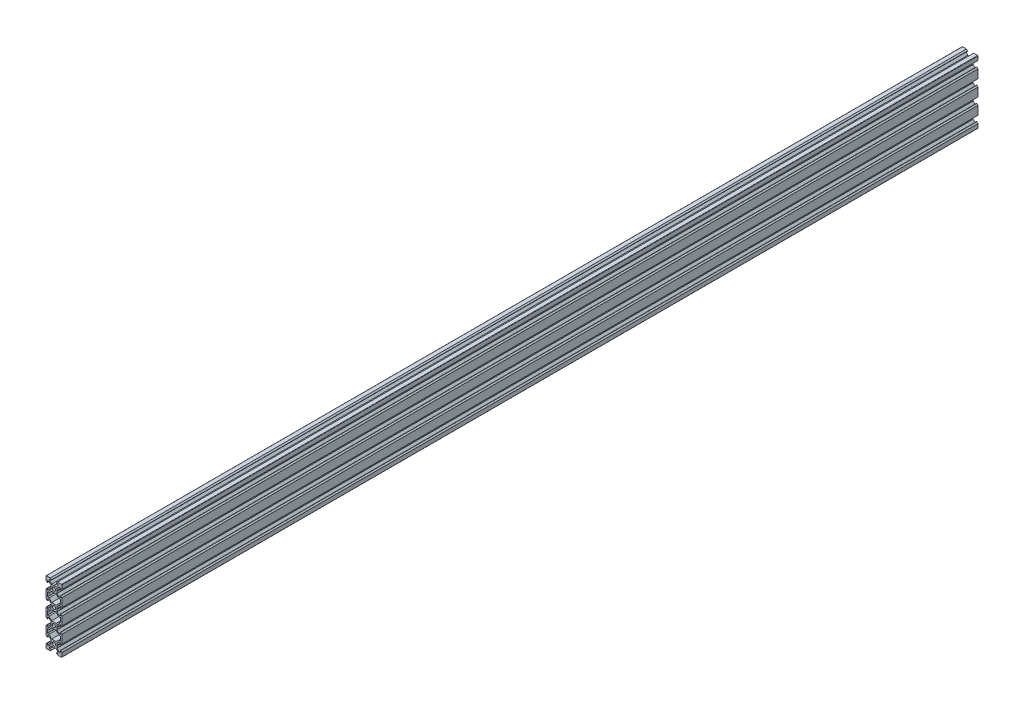
from build123d import *

# Parameters (mm, degrees)
V_SLOT_START                            = -48.53464623
V_SLOT_20X80X1000_LINEAR_RAIL_OUTLINE_R = 2.1
V_SLOT_20X80X1000_LINEAR_RAIL_DEPTH     = 1000
BOSS_EXTRUDE1_START                     = 160
SKETCH1_R                               = 2.1
BOSS_EXTRUDE1_DEPTH                     = 160


# Read off the part's stored shape, not the designer's step: V-Slot 20x80x1000 Linear Rail
with BuildPart() as part:
    # V-Slot 20x80x1000 Linear Rail outline → V-Slot 20x80x1000 Linear Rail (new body)
    with BuildSketch(Plane.XY.offset(V_SLOT_START)):
        with BuildLine():
            Line((20.643413128, 85.594922365), (20.643413128, 88.224262193))
            Line((20.643413128, 88.224262193), (20.433413128, 88.434262193))
            Line((20.433413128, 88.434262193), (20.643413128, 88.644262193))
            Line((20.643413128, 88.644262193), (20.643413128, 91.273602021))
            Line((20.643413128, 91.273602021), (23.3040733, 93.934262193))
            Line((23.3040733, 93.934262193), (24.943413128, 93.934262193))
            Line((24.943413128, 93.934262193), (24.943413128, 91.559262193))
            Line((24.943413128, 91.559262193), (25.288413128, 91.559262193))
            Line((25.288413128, 91.559262193), (26.743413128, 93.014262193))
            Line((26.743413128, 93.014262193), (26.743413128, 97.934262193))
            ThreePointArc((26.743413128, 97.934262193), (26.596966518, 98.287815583), (26.243413128, 98.434262193))
            Line((26.243413128, 98.434262193), (21.323413128, 98.434262193))
            Line((21.323413128, 98.434262193), (19.868413128, 96.979262193))
            Line((19.868413128, 96.979262193), (19.868413128, 96.634262193))
            Line((19.868413128, 96.634262193), (22.243413128, 96.634262193))
            Line((22.243413128, 96.634262193), (22.243413128, 94.994922365))
            Line((22.243413128, 94.994922365), (19.582752956, 92.334262193))
            Line((19.582752956, 92.334262193), (16.953413128, 92.334262193))
            Line((16.953413128, 92.334262193), (16.743413128, 92.124262193))
            Line((16.743413128, 92.124262193), (16.533413128, 92.334262193))
            Line((16.533413128, 92.334262193), (13.9040733, 92.334262193))
            Line((13.9040733, 92.334262193), (11.243413128, 94.994922365))
            Line((11.243413128, 94.994922365), (11.243413128, 96.634262193))
            Line((11.243413128, 96.634262193), (13.618413128, 96.634262193))
            Line((13.618413128, 96.634262193), (13.618413128, 96.979262193))
            Line((13.618413128, 96.979262193), (12.163413128, 98.434262193))
            Line((12.163413128, 98.434262193), (7.243413128, 98.434262193))
            ThreePointArc((7.243413128, 98.434262193), (6.889859737, 98.287815583), (6.743413128, 97.934262193))
            Line((6.743413128, 97.934262193), (6.743413128, 93.014262193))
            Line((6.743413128, 93.014262193), (8.198413128, 91.559262193))
            Line((8.198413128, 91.559262193), (8.543413128, 91.559262193))
            Line((8.543413128, 91.559262193), (8.543413128, 93.934262193))
            Line((8.543413128, 93.934262193), (10.182752956, 93.934262193))
            Line((10.182752956, 93.934262193), (12.843413128, 91.273602021))
            Line((12.843413128, 91.273602021), (12.843413128, 88.644262193))
            Line((12.843413128, 88.644262193), (13.053413128, 88.434262193))
            Line((13.053413128, 88.434262193), (12.843413128, 88.224262193))
            Line((12.843413128, 88.224262193), (12.843413128, 85.594922365))
            Line((12.843413128, 85.594922365), (10.182752956, 82.934262193))
            Line((10.182752956, 82.934262193), (8.543413128, 82.934262193))
            Line((8.543413128, 82.934262193), (8.543413128, 85.309262193))
            Line((8.543413128, 85.309262193), (8.198413128, 85.309262193))
            Line((8.198413128, 85.309262193), (6.743413128, 83.854262193))
            Line((6.743413128, 83.854262193), (6.743413128, 73.014262193))
            Line((6.743413128, 73.014262193), (8.198413128, 71.559262193))
            Line((8.198413128, 71.559262193), (8.543413128, 71.559262193))
            Line((8.543413128, 71.559262193), (8.543413128, 73.934262193))
            Line((8.543413128, 73.934262193), (10.182752956, 73.934262193))
            Line((10.182752956, 73.934262193), (12.843413128, 71.273602021))
            Line((12.843413128, 71.273602021), (12.843413128, 68.644262193))
            Line((12.843413128, 68.644262193), (13.053413128, 68.434262193))
            Line((13.053413128, 68.434262193), (12.843413128, 68.224262193))
            Line((12.843413128, 68.224262193), (12.843413128, 65.594922365))
            Line((12.843413128, 65.594922365), (10.182752956, 62.934262193))
            Line((10.182752956, 62.934262193), (8.543413128, 62.934262193))
            Line((8.543413128, 62.934262193), (8.543413128, 65.309262193))
            Line((8.543413128, 65.309262193), (8.198413128, 65.309262193))
            Line((8.198413128, 65.309262193), (6.743413128, 63.854262193))
            Line((6.743413128, 63.854262193), (6.743413128, 53.014262193))
            Line((6.743413128, 53.014262193), (8.198413128, 51.559262193))
            Line((8.198413128, 51.559262193), (8.543413128, 51.559262193))
            Line((8.543413128, 51.559262193), (8.543413128, 53.934262193))
            Line((8.543413128, 53.934262193), (10.182752956, 53.934262193))
            Line((10.182752956, 53.934262193), (12.843413128, 51.273602021))
            Line((12.843413128, 51.273602021), (12.843413128, 48.644262193))
            Line((12.843413128, 48.644262193), (13.053413128, 48.434262193))
            Line((13.053413128, 48.434262193), (12.843413128, 48.224262193))
            Line((12.843413128, 48.224262193), (12.843413128, 45.594922365))
            Line((12.843413128, 45.594922365), (10.182752956, 42.934262193))
            Line((10.182752956, 42.934262193), (8.543413128, 42.934262193))
            Line((8.543413128, 42.934262193), (8.543413128, 45.309262193))
            Line((8.543413128, 45.309262193), (8.198413128, 45.309262193))
            Line((8.198413128, 45.309262193), (6.743413128, 43.854262193))
            Line((6.743413128, 43.854262193), (6.743413128, 33.014262193))
            Line((6.743413128, 33.014262193), (8.198413128, 31.559262193))
            Line((8.198413128, 31.559262193), (8.543413128, 31.559262193))
            Line((8.543413128, 31.559262193), (8.543413128, 33.934262193))
            Line((8.543413128, 33.934262193), (10.182752956, 33.934262193))
            Line((10.182752956, 33.934262193), (12.843413128, 31.273602021))
            Line((12.843413128, 31.273602021), (12.843413128, 28.644262193))
            Line((12.843413128, 28.644262193), (13.053413128, 28.434262193))
            Line((13.053413128, 28.434262193), (12.843413128, 28.224262193))
            Line((12.843413128, 28.224262193), (12.843413128, 25.594922365))
            Line((12.843413128, 25.594922365), (10.182752956, 22.934262193))
            Line((10.182752956, 22.934262193), (8.543413128, 22.934262193))
            Line((8.543413128, 22.934262193), (8.543413128, 25.309262193))
            Line((8.543413128, 25.309262193), (8.198413128, 25.309262193))
            Line((8.198413128, 25.309262193), (6.743413128, 23.854262193))
            Line((6.743413128, 23.854262193), (6.743413128, 18.934262193))
            ThreePointArc((6.743413128, 18.934262193), (6.889859737, 18.580708802), (7.243413128, 18.434262193))
            Line((7.243413128, 18.434262193), (12.163413128, 18.434262193))
            Line((12.163413128, 18.434262193), (13.618413128, 19.889262193))
            Line((13.618413128, 19.889262193), (13.618413128, 20.234262193))
            Line((13.618413128, 20.234262193), (11.243413128, 20.234262193))
            Line((11.243413128, 20.234262193), (11.243413128, 21.873602021))
            Line((11.243413128, 21.873602021), (13.9040733, 24.534262193))
            Line((13.9040733, 24.534262193), (16.533413128, 24.534262193))
            Line((16.533413128, 24.534262193), (16.743413128, 24.744262193))
            Line((16.743413128, 24.744262193), (16.953413128, 24.534262193))
            Line((16.953413128, 24.534262193), (19.582752956, 24.534262193))
            Line((19.582752956, 24.534262193), (22.243413128, 21.873602021))
            Line((22.243413128, 21.873602021), (22.243413128, 20.234262193))
            Line((22.243413128, 20.234262193), (19.868413128, 20.234262193))
            Line((19.868413128, 20.234262193), (19.868413128, 19.889262193))
            Line((19.868413128, 19.889262193), (21.323413128, 18.434262193))
            Line((21.323413128, 18.434262193), (26.243413128, 18.434262193))
            ThreePointArc((26.243413128, 18.434262193), (26.596966519, 18.580708802), (26.743413128, 18.934262193))
            Line((26.743413128, 18.934262193), (26.743413128, 23.854262193))
            Line((26.743413128, 23.854262193), (25.288413128, 25.309262193))
            Line((25.288413128, 25.309262193), (24.943413128, 25.309262193))
            Line((24.943413128, 25.309262193), (24.943413128, 22.934262193))
            Line((24.943413128, 22.934262193), (23.3040733, 22.934262193))
            Line((23.3040733, 22.934262193), (20.643413128, 25.594922365))
            Line((20.643413128, 25.594922365), (20.643413128, 28.224262193))
            Line((20.643413128, 28.224262193), (20.433413128, 28.434262193))
            Line((20.433413128, 28.434262193), (20.643413128, 28.644262193))
            Line((20.643413128, 28.644262193), (20.643413128, 31.273602021))
            Line((20.643413128, 31.273602021), (23.3040733, 33.934262193))
            Line((23.3040733, 33.934262193), (24.943413128, 33.934262193))
            Line((24.943413128, 33.934262193), (24.943413128, 31.559262193))
            Line((24.943413128, 31.559262193), (25.288413128, 31.559262193))
            Line((25.288413128, 31.559262193), (26.743413128, 33.014262193))
            Line((26.743413128, 33.014262193), (26.743413128, 43.854262193))
            Line((26.743413128, 43.854262193), (25.288413128, 45.309262193))
            Line((25.288413128, 45.309262193), (24.943413128, 45.309262193))
            Line((24.943413128, 45.309262193), (24.943413128, 42.934262193))
            Line((24.943413128, 42.934262193), (23.3040733, 42.934262193))
            Line((23.3040733, 42.934262193), (20.643413128, 45.594922365))
            Line((20.643413128, 45.594922365), (20.643413128, 48.224262193))
            Line((20.643413128, 48.224262193), (20.433413128, 48.434262193))
            Line((20.433413128, 48.434262193), (20.643413128, 48.644262193))
            Line((20.643413128, 48.644262193), (20.643413128, 51.273602021))
            Line((20.643413128, 51.273602021), (23.3040733, 53.934262193))
            Line((23.3040733, 53.934262193), (24.943413128, 53.934262193))
            Line((24.943413128, 53.934262193), (24.943413128, 51.559262193))
            Line((24.943413128, 51.559262193), (25.288413128, 51.559262193))
            Line((25.288413128, 51.559262193), (26.743413128, 53.014262193))
            Line((26.743413128, 53.014262193), (26.743413128, 63.854262193))
            Line((26.743413128, 63.854262193), (25.288413128, 65.309262193))
            Line((25.288413128, 65.309262193), (24.943413128, 65.309262193))
            Line((24.943413128, 65.309262193), (24.943413128, 62.934262193))
            Line((24.943413128, 62.934262193), (23.3040733, 62.934262193))
            Line((23.3040733, 62.934262193), (20.643413128, 65.594922365))
            Line((20.643413128, 65.594922365), (20.643413128, 68.224262193))
            Line((20.643413128, 68.224262193), (20.433413128, 68.434262193))
            Line((20.433413128, 68.434262193), (20.643413128, 68.644262193))
            Line((20.643413128, 68.644262193), (20.643413128, 71.273602021))
            Line((20.643413128, 71.273602021), (23.3040733, 73.934262193))
            Line((23.3040733, 73.934262193), (24.943413128, 73.934262193))
            Line((24.943413128, 73.934262193), (24.943413128, 71.559262193))
            Line((24.943413128, 71.559262193), (25.288413128, 71.559262193))
            Line((25.288413128, 71.559262193), (26.743413128, 73.014262193))
            Line((26.743413128, 73.014262193), (26.743413128, 83.854262193))
            Line((26.743413128, 83.854262193), (25.288413128, 85.309262193))
            Line((25.288413128, 85.309262193), (24.943413128, 85.309262193))
            Line((24.943413128, 85.309262193), (24.943413128, 82.934262193))
            Line((24.943413128, 82.934262193), (23.3040733, 82.934262193))
            Line((23.3040733, 82.934262193), (20.643413128, 85.594922365))
        make_face()
        with Locations((16.743413128, 28.434262193)):
            Circle(V_SLOT_20X80X1000_LINEAR_RAIL_OUTLINE_R, mode=Mode.SUBTRACT)
        Polygon((13.9040733, 32.334262193), (10.5040733, 35.734262193), (8.543413128, 35.734262193), (8.543413128, 41.134262193), (10.5040733, 41.134262193), (13.9040733, 44.534262193), (19.582752956, 44.534262193), (22.982752956, 41.134262193), (24.943413128, 41.134262193), (24.943413128, 35.734262193), (22.982752956, 35.734262193), (19.582752956, 32.334262193), align=None, mode=Mode.SUBTRACT)
        with Locations((16.743413128, 48.434262193)):
            Circle(V_SLOT_20X80X1000_LINEAR_RAIL_OUTLINE_R, mode=Mode.SUBTRACT)
        Polygon((13.9040733, 52.334262193), (10.5040733, 55.734262193), (8.543413128, 55.734262193), (8.543413128, 61.134262193), (10.5040733, 61.134262193), (13.9040733, 64.534262193), (19.582752956, 64.534262193), (22.982752956, 61.134262193), (24.943413128, 61.134262193), (24.943413128, 55.734262193), (22.982752956, 55.734262193), (19.582752956, 52.334262193), align=None, mode=Mode.SUBTRACT)
        with Locations((16.743413128, 68.434262193)):
            Circle(V_SLOT_20X80X1000_LINEAR_RAIL_OUTLINE_R, mode=Mode.SUBTRACT)
        Polygon((13.9040733, 72.334262193), (10.5040733, 75.734262193), (8.543413128, 75.734262193), (8.543413128, 81.134262193), (10.5040733, 81.134262193), (13.9040733, 84.534262193), (19.582752956, 84.534262193), (22.982752956, 81.134262193), (24.943413128, 81.134262193), (24.943413128, 75.734262193), (22.982752956, 75.734262193), (19.582752956, 72.334262193), align=None, mode=Mode.SUBTRACT)
        with Locations((16.743413128, 88.434262193)):
            Circle(V_SLOT_20X80X1000_LINEAR_RAIL_OUTLINE_R, mode=Mode.SUBTRACT)
    extrude(amount=V_SLOT_20X80X1000_LINEAR_RAIL_DEPTH)

    # Sketch1 → Boss-Extrude1 (add)
    with BuildSketch(Plane(origin=(0, 0, -48.53464623), x_dir=(-1, 0, 0), z_dir=(0, 0, -1)).offset(BOSS_EXTRUDE1_START)):
        with BuildLine():
            Line((-20.433413128, 88.434262193), (-20.643413128, 88.224262193))
            Line((-20.643413128, 88.224262193), (-20.643413128, 85.594922365))
            Line((-20.643413128, 85.594922365), (-23.3040733, 82.934262193))
            Line((-23.3040733, 82.934262193), (-24.943413128, 82.934262193))
            Line((-24.943413128, 82.934262193), (-24.943413128, 85.309262193))
            Line((-24.943413128, 85.309262193), (-25.288413128, 85.309262193))
            Line((-25.288413128, 85.309262193), (-26.743413128, 83.854262193))
            Line((-26.743413128, 83.854262193), (-26.743413128, 73.014262193))
            Line((-26.743413128, 73.014262193), (-25.288413128, 71.559262193))
            Line((-25.288413128, 71.559262193), (-24.943413128, 71.559262193))
            Line((-24.943413128, 71.559262193), (-24.943413128, 73.934262193))
            Line((-24.943413128, 73.934262193), (-23.3040733, 73.934262193))
            Line((-23.3040733, 73.934262193), (-20.643413128, 71.273602021))
            Line((-20.643413128, 71.273602021), (-20.643413128, 68.644262193))
            Line((-20.643413128, 68.644262193), (-20.433413128, 68.434262193))
            Line((-20.433413128, 68.434262193), (-20.643413128, 68.224262193))
            Line((-20.643413128, 68.224262193), (-20.643413128, 65.594922365))
            Line((-20.643413128, 65.594922365), (-23.3040733, 62.934262193))
            Line((-23.3040733, 62.934262193), (-24.943413128, 62.934262193))
            Line((-24.943413128, 62.934262193), (-24.943413128, 65.309262193))
            Line((-24.943413128, 65.309262193), (-25.288413128, 65.309262193))
            Line((-25.288413128, 65.309262193), (-26.743413128, 63.854262193))
            Line((-26.743413128, 63.854262193), (-26.743413128, 53.014262193))
            Line((-26.743413128, 53.014262193), (-25.288413128, 51.559262193))
            Line((-25.288413128, 51.559262193), (-24.943413128, 51.559262193))
            Line((-24.943413128, 51.559262193), (-24.943413128, 53.934262193))
            Line((-24.943413128, 53.934262193), (-23.3040733, 53.934262193))
            Line((-23.3040733, 53.934262193), (-20.643413128, 51.273602021))
            Line((-20.643413128, 51.273602021), (-20.643413128, 48.644262193))
            Line((-20.643413128, 48.644262193), (-20.433413128, 48.434262193))
            Line((-20.433413128, 48.434262193), (-20.643413128, 48.224262193))
            Line((-20.643413128, 48.224262193), (-20.643413128, 45.594922365))
            Line((-20.643413128, 45.594922365), (-23.3040733, 42.934262193))
            Line((-23.3040733, 42.934262193), (-24.943413128, 42.934262193))
            Line((-24.943413128, 42.934262193), (-24.943413128, 45.309262193))
            Line((-24.943413128, 45.309262193), (-25.288413128, 45.309262193))
            Line((-25.288413128, 45.309262193), (-26.743413128, 43.854262193))
            Line((-26.743413128, 43.854262193), (-26.743413128, 33.014262193))
            Line((-26.743413128, 33.014262193), (-25.288413128, 31.559262193))
            Line((-25.288413128, 31.559262193), (-24.943413128, 31.559262193))
            Line((-24.943413128, 31.559262193), (-24.943413128, 33.934262193))
            Line((-24.943413128, 33.934262193), (-23.3040733, 33.934262193))
            Line((-23.3040733, 33.934262193), (-20.643413128, 31.273602021))
            Line((-20.643413128, 31.273602021), (-20.643413128, 28.644262193))
            Line((-20.643413128, 28.644262193), (-20.433413128, 28.434262193))
            Line((-20.433413128, 28.434262193), (-20.643413128, 28.224262193))
            Line((-20.643413128, 28.224262193), (-20.643413128, 25.594922365))
            Line((-20.643413128, 25.594922365), (-23.3040733, 22.934262193))
            Line((-23.3040733, 22.934262193), (-24.943413128, 22.934262193))
            Line((-24.943413128, 22.934262193), (-24.943413128, 25.309262193))
            Line((-24.943413128, 25.309262193), (-25.288413128, 25.309262193))
            Line((-25.288413128, 25.309262193), (-26.743413128, 23.854262193))
            Line((-26.743413128, 23.854262193), (-26.743413128, 18.934262193))
            ThreePointArc((-26.743413128, 18.934262193), (-26.596966518, 18.580708802), (-26.243413128, 18.434262193))
            Line((-26.243413128, 18.434262193), (-21.323413128, 18.434262193))
            Line((-21.323413128, 18.434262193), (-19.868413128, 19.889262193))
            Line((-19.868413128, 19.889262193), (-19.868413128, 20.234262193))
            Line((-19.868413128, 20.234262193), (-22.243413128, 20.234262193))
            Line((-22.243413128, 20.234262193), (-22.243413128, 21.873602021))
            Line((-22.243413128, 21.873602021), (-19.582752956, 24.534262193))
            Line((-19.582752956, 24.534262193), (-16.953413128, 24.534262193))
            Line((-16.953413128, 24.534262193), (-16.743413128, 24.744262193))
            Line((-16.743413128, 24.744262193), (-16.533413128, 24.534262193))
            Line((-16.533413128, 24.534262193), (-13.9040733, 24.534262193))
            Line((-13.9040733, 24.534262193), (-11.243413128, 21.873602021))
            Line((-11.243413128, 21.873602021), (-11.243413128, 20.234262193))
            Line((-11.243413128, 20.234262193), (-13.618413128, 20.234262193))
            Line((-13.618413128, 20.234262193), (-13.618413128, 19.889262193))
            Line((-13.618413128, 19.889262193), (-12.163413128, 18.434262193))
            Line((-12.163413128, 18.434262193), (-7.243413128, 18.434262193))
            ThreePointArc((-7.243413128, 18.434262193), (-6.889859737, 18.580708802), (-6.743413128, 18.934262193))
            Line((-6.743413128, 18.934262193), (-6.743413128, 23.854262193))
            Line((-6.743413128, 23.854262193), (-8.198413128, 25.309262193))
            Line((-8.198413128, 25.309262193), (-8.543413128, 25.309262193))
            Line((-8.543413128, 25.309262193), (-8.543413128, 22.934262193))
            Line((-8.543413128, 22.934262193), (-10.182752956, 22.934262193))
            Line((-10.182752956, 22.934262193), (-12.843413128, 25.594922365))
            Line((-12.843413128, 25.594922365), (-12.843413128, 28.224262193))
            Line((-12.843413128, 28.224262193), (-13.053413128, 28.434262193))
            Line((-13.053413128, 28.434262193), (-12.843413128, 28.644262193))
            Line((-12.843413128, 28.644262193), (-12.843413128, 31.273602021))
            Line((-12.843413128, 31.273602021), (-10.182752956, 33.934262193))
            Line((-10.182752956, 33.934262193), (-8.543413128, 33.934262193))
            Line((-8.543413128, 33.934262193), (-8.543413128, 31.559262193))
            Line((-8.543413128, 31.559262193), (-8.198413128, 31.559262193))
            Line((-8.198413128, 31.559262193), (-6.743413128, 33.014262193))
            Line((-6.743413128, 33.014262193), (-6.743413128, 43.854262193))
            Line((-6.743413128, 43.854262193), (-8.198413128, 45.309262193))
            Line((-8.198413128, 45.309262193), (-8.543413128, 45.309262193))
            Line((-8.543413128, 45.309262193), (-8.543413128, 42.934262193))
            Line((-8.543413128, 42.934262193), (-10.182752956, 42.934262193))
            Line((-10.182752956, 42.934262193), (-12.843413128, 45.594922365))
            Line((-12.843413128, 45.594922365), (-12.843413128, 48.224262193))
            Line((-12.843413128, 48.224262193), (-13.053413128, 48.434262193))
            Line((-13.053413128, 48.434262193), (-12.843413128, 48.644262193))
            Line((-12.843413128, 48.644262193), (-12.843413128, 51.273602021))
            Line((-12.843413128, 51.273602021), (-10.182752956, 53.934262193))
            Line((-10.182752956, 53.934262193), (-8.543413128, 53.934262193))
            Line((-8.543413128, 53.934262193), (-8.543413128, 51.559262193))
            Line((-8.543413128, 51.559262193), (-8.198413128, 51.559262193))
            Line((-8.198413128, 51.559262193), (-6.743413128, 53.014262193))
            Line((-6.743413128, 53.014262193), (-6.743413128, 63.854262193))
            Line((-6.743413128, 63.854262193), (-8.198413128, 65.309262193))
            Line((-8.198413128, 65.309262193), (-8.543413128, 65.309262193))
            Line((-8.543413128, 65.309262193), (-8.543413128, 62.934262193))
            Line((-8.543413128, 62.934262193), (-10.182752956, 62.934262193))
            Line((-10.182752956, 62.934262193), (-12.843413128, 65.594922365))
            Line((-12.843413128, 65.594922365), (-12.843413128, 68.224262193))
            Line((-12.843413128, 68.224262193), (-13.053413128, 68.434262193))
            Line((-13.053413128, 68.434262193), (-12.843413128, 68.644262193))
            Line((-12.843413128, 68.644262193), (-12.843413128, 71.273602021))
            Line((-12.843413128, 71.273602021), (-10.182752956, 73.934262193))
            Line((-10.182752956, 73.934262193), (-8.543413128, 73.934262193))
            Line((-8.543413128, 73.934262193), (-8.543413128, 71.559262193))
            Line((-8.543413128, 71.559262193), (-8.198413128, 71.559262193))
            Line((-8.198413128, 71.559262193), (-6.743413128, 73.014262193))
            Line((-6.743413128, 73.014262193), (-6.743413128, 83.854262193))
            Line((-6.743413128, 83.854262193), (-8.198413128, 85.309262193))
            Line((-8.198413128, 85.309262193), (-8.543413128, 85.309262193))
            Line((-8.543413128, 85.309262193), (-8.543413128, 82.934262193))
            Line((-8.543413128, 82.934262193), (-10.182752956, 82.934262193))
            Line((-10.182752956, 82.934262193), (-12.843413128, 85.594922365))
            Line((-12.843413128, 85.594922365), (-12.843413128, 88.224262193))
            Line((-12.843413128, 88.224262193), (-13.053413128, 88.434262193))
            Line((-13.053413128, 88.434262193), (-12.843413128, 88.644262193))
            Line((-12.843413128, 88.644262193), (-12.843413128, 91.273602021))
            Line((-12.843413128, 91.273602021), (-10.182752956, 93.934262193))
            Line((-10.182752956, 93.934262193), (-8.543413128, 93.934262193))
            Line((-8.543413128, 93.934262193), (-8.543413128, 91.559262193))
            Line((-8.543413128, 91.559262193), (-8.198413128, 91.559262193))
            Line((-8.198413128, 91.559262193), (-6.743413128, 93.014262193))
            Line((-6.743413128, 93.014262193), (-6.743413128, 97.934262193))
            ThreePointArc((-6.743413128, 97.934262193), (-6.889859737, 98.287815583), (-7.243413128, 98.434262193))
            Line((-7.243413128, 98.434262193), (-12.163413128, 98.434262193))
            Line((-12.163413128, 98.434262193), (-13.618413128, 96.979262193))
            Line((-13.618413128, 96.979262193), (-13.618413128, 96.634262193))
            Line((-13.618413128, 96.634262193), (-11.243413128, 96.634262193))
            Line((-11.243413128, 96.634262193), (-11.243413128, 94.994922365))
            Line((-11.243413128, 94.994922365), (-13.9040733, 92.334262193))
            Line((-13.9040733, 92.334262193), (-16.533413128, 92.334262193))
            Line((-16.533413128, 92.334262193), (-16.743413128, 92.124262193))
            Line((-16.743413128, 92.124262193), (-16.953413128, 92.334262193))
            Line((-16.953413128, 92.334262193), (-19.582752956, 92.334262193))
            Line((-19.582752956, 92.334262193), (-22.243413128, 94.994922365))
            Line((-22.243413128, 94.994922365), (-22.243413128, 96.634262193))
            Line((-22.243413128, 96.634262193), (-19.868413128, 96.634262193))
            Line((-19.868413128, 96.634262193), (-19.868413128, 96.979262193))
            Line((-19.868413128, 96.979262193), (-21.323413128, 98.434262193))
            Line((-21.323413128, 98.434262193), (-26.243413128, 98.434262193))
            ThreePointArc((-26.243413128, 98.434262193), (-26.596966518, 98.287815583), (-26.743413128, 97.934262193))
            Line((-26.743413128, 97.934262193), (-26.743413128, 93.014262193))
            Line((-26.743413128, 93.014262193), (-25.288413128, 91.559262193))
            Line((-25.288413128, 91.559262193), (-24.943413128, 91.559262193))
            Line((-24.943413128, 91.559262193), (-24.943413128, 93.934262193))
            Line((-24.943413128, 93.934262193), (-23.3040733, 93.934262193))
            Line((-23.3040733, 93.934262193), (-20.643413128, 91.273602021))
            Line((-20.643413128, 91.273602021), (-20.643413128, 88.644262193))
            Line((-20.643413128, 88.644262193), (-20.433413128, 88.434262193))
        make_face()
        with Locations((-16.743413128, 28.434262193)):
            Circle(SKETCH1_R, mode=Mode.SUBTRACT)
        with Locations((-16.743413128, 48.434262193)):
            Circle(SKETCH1_R, mode=Mode.SUBTRACT)
        with Locations((-16.743413128, 68.434262193)):
            Circle(SKETCH1_R, mode=Mode.SUBTRACT)
        with Locations((-16.743413128, 88.434262193)):
            Circle(SKETCH1_R, mode=Mode.SUBTRACT)
        Polygon((-22.982752956, 41.134262193), (-19.582752956, 44.534262193), (-13.9040733, 44.534262193), (-10.5040733, 41.134262193), (-8.543413128, 41.134262193), (-8.543413128, 35.734262193), (-10.5040733, 35.734262193), (-13.9040733, 32.334262193), (-19.582752956, 32.334262193), (-22.982752956, 35.734262193), (-24.943413128, 35.734262193), (-24.943413128, 41.134262193), align=None, mode=Mode.SUBTRACT)
        Polygon((-22.982752956, 61.134262193), (-19.582752956, 64.534262193), (-13.9040733, 64.534262193), (-10.5040733, 61.134262193), (-8.543413128, 61.134262193), (-8.543413128, 55.734262193), (-10.5040733, 55.734262193), (-13.9040733, 52.334262193), (-19.582752956, 52.334262193), (-22.982752956, 55.734262193), (-24.943413128, 55.734262193), (-24.943413128, 61.134262193), align=None, mode=Mode.SUBTRACT)
        Polygon((-22.982752956, 81.134262193), (-19.582752956, 84.534262193), (-13.9040733, 84.534262193), (-10.5040733, 81.134262193), (-8.543413128, 81.134262193), (-8.543413128, 75.734262193), (-10.5040733, 75.734262193), (-13.9040733, 72.334262193), (-19.582752956, 72.334262193), (-22.982752956, 75.734262193), (-24.943413128, 75.734262193), (-24.943413128, 81.134262193), align=None, mode=Mode.SUBTRACT)
    extrude(amount=-BOSS_EXTRUDE1_DEPTH)


solid = part.part
